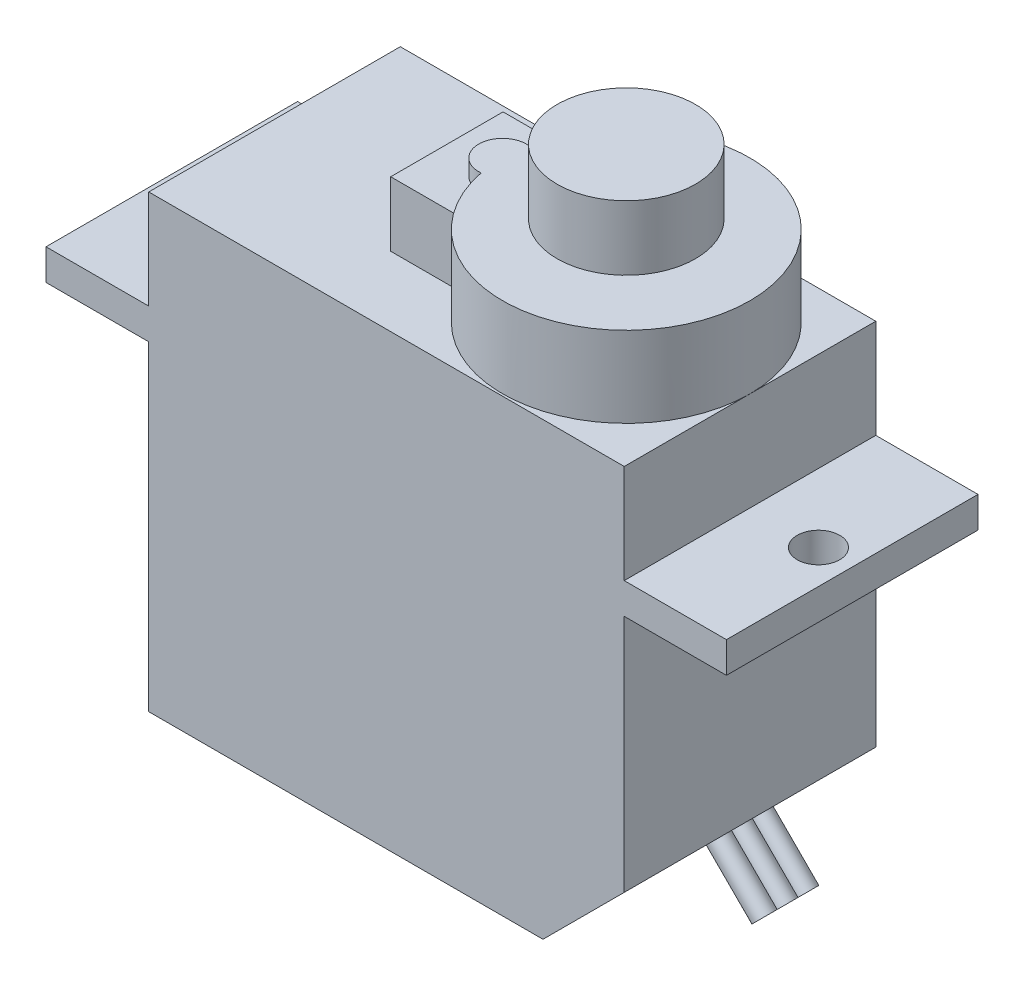
from build123d import *

# Parameters (mm, degrees)
BOSS_EXTRUDE1_DEPTH     = 12.2
SKETCH4_W               = 33
SKETCH4_H               = 1.5
BOSS_EXTRUDE2_DEPTH     = 12.2
CUT_EXTRUDE1_DEPTH      = 35.968525165
CUT_EXTRUDE1_DEPTH_BACK = 35.968525165
SKETCH6_R               = 1.03
CUT_EXTRUDE2_DEPTH      = 35.968525165
CUT_EXTRUDE2_DEPTH_BACK = 35.968525165
SKETCH7_R               = 1.03
SKETCH9_R               = 6
BOSS_EXTRUDE3_DEPTH     = 8.74
SKETCH11_R              = 1.16
BOSS_EXTRUDE4_DEPTH     = 8.74
SKETCH13_W              = 5.4
SKETCH13_H              = 5.45
BOSS_EXTRUDE5_DEPTH     = 7.96
SKETCH14_R              = 2.345
BOSS_EXTRUDE6_DEPTH     = 11.51
SKETCH15_R              = 0.635
CUT_EXTRUDE3_DEPTH      = 3.13
BOSS_EXTRUDE7_START     = 0.8
SKETCH17_R              = 3.355
BOSS_EXTRUDE7_DEPTH     = 3.13
SKETCH18_R              = 0.5
BOSS_EXTRUDE8_DEPTH     = 3.13


with BuildPart() as part:
    # Sketch1 → Boss-Extrude1 (new body)
    with BuildSketch(Plane.XY):
        Polygon((19.12, 0), (23.06, 3.94), (23.06, 21.83), (0, 21.83), (0, 0), align=None)
    extrude(amount=-BOSS_EXTRUDE1_DEPTH)



with BuildPart() as body_2:
    # Sketch4 → Boss-Extrude2 (new body)
    with BuildSketch(Plane.XY):
        with Locations((11.517097498, 16.2852801)):
            Rectangle(SKETCH4_W, SKETCH4_H)
    extrude(amount=-BOSS_EXTRUDE2_DEPTH)

    # Sketch6 → Cut-Extrude1 (cut, two sides: drawn at the far end of the back side and taken through both)
    with BuildSketch(Plane(origin=(0, 17, 0), x_dir=(1, 0, 0), z_dir=(0, 1, 0)).offset(-CUT_EXTRUDE1_DEPTH_BACK)):
        with Locations((-3.31, 6.1)):
            Circle(SKETCH6_R)
    extrude(amount=CUT_EXTRUDE1_DEPTH + CUT_EXTRUDE1_DEPTH_BACK, mode=Mode.SUBTRACT)

    # Sketch7 → Cut-Extrude2 (cut, two sides: drawn at the far end of the back side and taken through both)
    with BuildSketch(Plane(origin=(0, 17, 0), x_dir=(1, 0, 0), z_dir=(0, 1, 0)).offset(-CUT_EXTRUDE2_DEPTH_BACK)):
        with Locations((26.38, 6.1)):
            Circle(SKETCH7_R)
    extrude(amount=CUT_EXTRUDE2_DEPTH + CUT_EXTRUDE2_DEPTH_BACK, mode=Mode.SUBTRACT)


with BuildPart() as part_1:
    add(part.part)

    add(body_2.part)  # Boss-Extrude3 merges body 2
    # Sketch9 → Boss-Extrude3 (add)
    with BuildSketch(Plane(origin=(0, 17, 0), x_dir=(1, 0, 0), z_dir=(0, 1, 0))):
        with Locations((17.06, 6.1)):
            Circle(SKETCH9_R)
    extrude(amount=BOSS_EXTRUDE3_DEPTH)

    # Sketch11 → Boss-Extrude4 (add)
    with BuildSketch(Plane(origin=(0, 17, 0), x_dir=(1, 0, 0), z_dir=(0, 1, 0))):
        with Locations((11.06, 6.1)):
            Circle(SKETCH11_R)
    extrude(amount=BOSS_EXTRUDE4_DEPTH)

    # Sketch13 → Boss-Extrude5 (add)
    with BuildSketch(Plane(origin=(0, 17, 0), x_dir=(1, 0, 0), z_dir=(0, 1, 0))):
        with Locations((11.06, 6.1)):
            Rectangle(SKETCH13_W, SKETCH13_H)
    extrude(amount=BOSS_EXTRUDE5_DEPTH)

    # Sketch14 → Boss-Extrude6 (add)
    with BuildSketch(Plane(origin=(0, 17, 0), x_dir=(1, 0, 0), z_dir=(0, 1, 0))):
        with Locations((17.06, 6.1)):
            Circle(SKETCH14_R)
    extrude(amount=BOSS_EXTRUDE6_DEPTH)

    # Sketch15 → Cut-Extrude3 (cut)
    with BuildSketch(Plane(origin=(0, 28.51, 0), x_dir=(1, 0, 0), z_dir=(0, 1, 0))):
        with Locations((17.06, 6.1)):
            Circle(SKETCH15_R)
    extrude(amount=-CUT_EXTRUDE3_DEPTH, mode=Mode.SUBTRACT)

    # Sketch17 → Boss-Extrude7 (add)
    with BuildSketch(Plane(origin=(0, 28.51, 0), x_dir=(1, 0, 0), z_dir=(0, 1, 0)).offset(BOSS_EXTRUDE7_START)):
        with Locations((17.06, 6.1)):
            Circle(SKETCH17_R)
    extrude(amount=-BOSS_EXTRUDE7_DEPTH)

    # Sketch18 → Boss-Extrude8 (add)
    with BuildSketch(Plane(origin=(9.56, -9.56, 0), x_dir=(0, 0, -1), z_dir=(0.7071067811865486, -0.7071067811865465, 0))):
        with Locations((5.09, 18.386997448)):
            Circle(SKETCH18_R)
        with Locations((6.1, 18.386997448)):
            Circle(SKETCH18_R)
        with Locations((7.11, 18.386997448)):
            Circle(SKETCH18_R)
    extrude(amount=BOSS_EXTRUDE8_DEPTH)


solid = part_1.part
